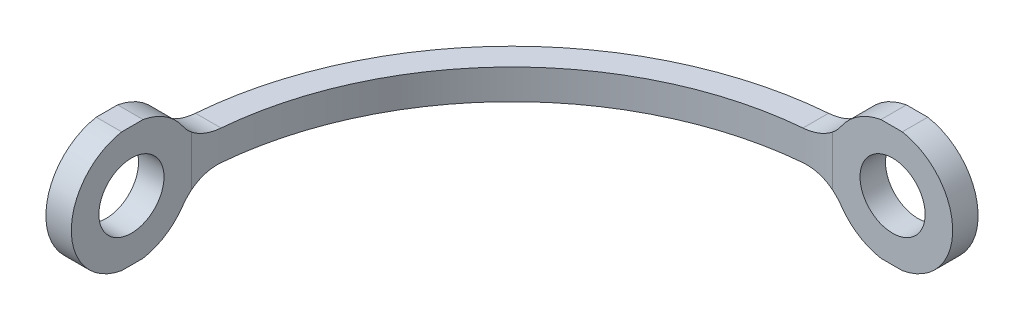
from build123d import *

# Parameters (mm, degrees)
SKETCH1_W             = 7.5
SKETCH1_H             = 1.5875
BOSS_EXTRUDE1_DEPTH   = 3.75
SKETCH1_W_2           = 1.5875
SKETCH1_H_2           = 7.5
BOSS_EXTRUDE1_2_DEPTH = 3.75
BOSS_EXTRUDE2_DEPTH   = 0.9375
SKETCH2_R             = 2.032
CUT_EXTRUDE1_DEPTH    = 38.580598801
SKETCH3_R             = 2.032
CUT_EXTRUDE2_DEPTH    = 38.580598801
FILLET5_R             = 2.8125


with BuildPart() as part:
    # Sketch1 → Boss-Extrude1 (new, symmetric)
    with BuildSketch(Plane(origin=(0, 0, 0), x_dir=(1, 0, 0), z_dir=(0, 1, 0))):
        with Locations((0, 24.54375)):
            Rectangle(SKETCH1_W, SKETCH1_H)
    extrude(amount=BOSS_EXTRUDE1_DEPTH, both=True)



with BuildPart() as body_2:
    # Sketch1 → Boss-Extrude1 2 (new, symmetric)
    with BuildSketch(Plane(origin=(0, 0, 0), x_dir=(1, 0, 0), z_dir=(0, 1, 0))):
        with Locations((-24.54375, 0)):
            Rectangle(SKETCH1_W_2, SKETCH1_H_2)
    extrude(amount=BOSS_EXTRUDE1_2_DEPTH, both=True)


with BuildPart() as part_1:
    add(part.part)

    add(body_2.part)  # Boss-Extrude2 merges body 2
    # Sketch1<3> → Boss-Extrude2 (add, symmetric)
    with BuildSketch(Plane(origin=(0, 0, 0), x_dir=(1, 0, 0), z_dir=(0, 1, 0))):
        with BuildLine():
            ThreePointArc((-23.75, 3.75), (-17.892135624, 17.892135624), (-3.75, 23.75))
            Line((-3.75, 23.75), (-3.75, 25.3375))
            ThreePointArc((-3.75, 25.3375), (-19.014667639, 19.014667639), (-25.3375, 3.75))
            Line((-25.3375, 3.75), (-23.75, 3.75))
        make_face()
    extrude(amount=BOSS_EXTRUDE2_DEPTH, both=True)

    # Sketch2 → Cut-Extrude1 (cut, through all)
    with BuildSketch(Plane.XY.offset(-23.75)):
        Circle(SKETCH2_R)
        with BuildLine():
            Line((-3.75, 3.75), (-3.75, 0.9375))
            ThreePointArc((-3.75, 0.9375), (-2.651505376, 2.789658698), (-0.724090822, 3.75))
            Line((-0.724090822, 3.75), (-3.75, 3.75))
        make_face()
        with BuildLine():
            ThreePointArc((-0.724090822, -3.75), (-2.651505376, -2.789658698), (-3.75, -0.9375))
            Line((-3.75, -0.9375), (-3.75, -3.75))
            Line((-3.75, -3.75), (-0.724090822, -3.75))
        make_face()
        with BuildLine():
            Line((3.75, 3.75), (0.606903322, 3.75))
            ThreePointArc((0.606903322, 3.75), (2.860309669, 2.446505504), (3.75, 0))
            Line((3.75, 0), (3.75, 3.75))
        make_face()
        with BuildLine():
            ThreePointArc((3.75, 0), (2.860309669, -2.446505504), (0.606903322, -3.75))
            Line((0.606903322, -3.75), (3.75, -3.75))
            Line((3.75, -3.75), (3.75, 0))
        make_face()
    extrude(amount=-CUT_EXTRUDE1_DEPTH, mode=Mode.SUBTRACT)

    # Sketch3 → Cut-Extrude2 (cut, through all)
    with BuildSketch(Plane(origin=(-23.75, 0, 0), x_dir=(0, 0, -1), z_dir=(1, 0, 0))):
        Circle(SKETCH3_R)
        with BuildLine():
            ThreePointArc((0.724090822, 3.75), (2.651505376, 2.789658698), (3.75, 0.9375))
            Line((3.75, 0.9375), (3.75, 3.75))
            Line((3.75, 3.75), (0.724090822, 3.75))
        make_face()
        with BuildLine():
            Line((3.75, -3.75), (3.75, -0.9375))
            ThreePointArc((3.75, -0.9375), (2.651505376, -2.789658698), (0.724090822, -3.75))
            Line((0.724090822, -3.75), (3.75, -3.75))
        make_face()
        with BuildLine():
            ThreePointArc((-3.75, 0), (-2.860309669, 2.446505504), (-0.606903322, 3.75))
            Line((-0.606903322, 3.75), (-3.75, 3.75))
            Line((-3.75, 3.75), (-3.75, 0))
        make_face()
        with BuildLine():
            Line((-3.75, -3.75), (-0.606903322, -3.75))
            ThreePointArc((-0.606903322, -3.75), (-2.860309669, -2.446505504), (-3.75, 0))
            Line((-3.75, 0), (-3.75, -3.75))
        make_face()
    extrude(amount=-CUT_EXTRUDE2_DEPTH, mode=Mode.SUBTRACT)

    # Fillet5
    fillet5_edges = [part_1.edges().sort_by_distance(p)[0] for p in [
        (-3.75, 0.9375, -24.54375),
    ]]
    fillet(fillet5_edges, radius=FILLET5_R)
    fillet5_2_edges = [part_1.edges().sort_by_distance(p)[0] for p in [
        (-24.54375, 0.9375, -3.75),
    ]]
    fillet(fillet5_2_edges, radius=FILLET5_R)
    fillet5_3_edges = [part_1.edges().sort_by_distance(p)[0] for p in [
        (-3.75, -0.9375, -24.54375),
    ]]
    fillet(fillet5_3_edges, radius=FILLET5_R)
    fillet5_4_edges = [part_1.edges().sort_by_distance(p)[0] for p in [
        (-24.54375, -0.9375, -3.75),
    ]]
    fillet(fillet5_4_edges, radius=FILLET5_R)


solid = part_1.part
